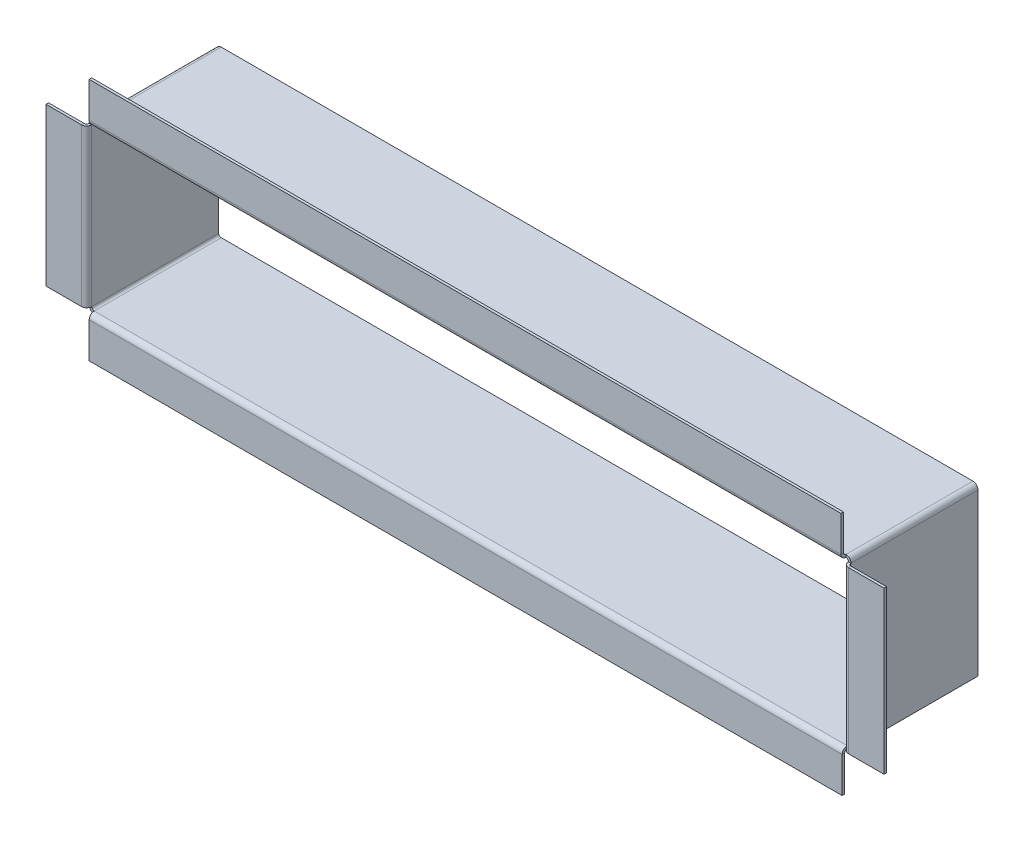
from build123d import *

# Parameters (mm, degrees)
SKETCH1_W                 = 300
SKETCH1_H                 = 66
SKETCH1_W_2               = 298
SKETCH1_H_2               = 64
BOSS_EXTRUDE1_DEPTH       = 50
CONVERT_SOLID1_DEPTH      = 50
CONVERT_SOLID1_2_DEPTH    = 50
EDGE_FLANGE1_DEPTH        = 296
EDGE_FLANGE1_BEND_DEPTH   = 63.5
EDGE_FLANGE1_BEND_2_DEPTH = 296.5
EDGE_FLANGE1_BEND_3_DEPTH = 62


# Read off the part's stored shape, not the designer's step: Convert-Solid1
# Sheet-metal steps are written as plain solids
with BuildPart() as part:
    # Sketch1 → Boss-Extrude1 (new body)
    with BuildSketch(Plane.XY):
        Rectangle(SKETCH1_W, SKETCH1_H)
        Rectangle(SKETCH1_W_2, SKETCH1_H_2, mode=Mode.SUBTRACT)
    extrude(amount=BOSS_EXTRUDE1_DEPTH)

    # Convert-Solid1 outline → Convert-Solid1 (cut)
    with BuildSketch(Plane.XY):
        Polygon((149, -32.5), (149, -32), (148.5, -32), (148.5, -33), (150, -33), (150, -32.5), align=None)
        with BuildLine():
            ThreePointArc((148, 33), (149.414213562, 32.414213562), (150, 31))
            Line((150, 31), (150, 33))
            Line((150, 33), (148, 33))
        make_face()
        with BuildLine():
            Line((-150, -33), (-148, -33))
            ThreePointArc((-148, -33), (-149.414213562, -32.414213562), (-150, -31))
            Line((-150, -31), (-150, -33))
        make_face()
        with BuildLine():
            ThreePointArc((-150, 31), (-149.414213562, 32.414213562), (-148, 33))
            Line((-148, 33), (-150, 33))
            Line((-150, 33), (-150, 31))
        make_face()
    extrude(amount=CONVERT_SOLID1_DEPTH, mode=Mode.SUBTRACT)

    # Convert-Solid1 2 outline → Convert-Solid1 2 (add)
    with BuildSketch(Plane.XY):
        with BuildLine():
            ThreePointArc((148, 32), (148.707106781, 31.707106781), (149, 31))
            Line((149, 31), (149, 32))
            Line((149, 32), (148, 32))
        make_face()
        with BuildLine():
            ThreePointArc((-149, 31), (-148.707106781, 31.707106781), (-148, 32))
            Line((-148, 32), (-149, 32))
            Line((-149, 32), (-149, 31))
        make_face()
        with BuildLine():
            Line((-149, -32), (-148, -32))
            ThreePointArc((-148, -32), (-148.707106781, -31.707106781), (-149, -31))
            Line((-149, -31), (-149, -32))
        make_face()
    extrude(amount=CONVERT_SOLID1_2_DEPTH)

    # Edge-Flange1 section (across the edge) → Edge-Flange1 (add)
    with BuildSketch(Plane(origin=(-148, 33, 51), x_dir=(0, 0, -1), z_dir=(1, 0, 0))):
        with BuildLine():
            Line((-1, 1), (-1, 15))
            Line((-1, 15), (0, 15))
            Line((0, 15), (0, 1))
            ThreePointArc((0, 1), (0.292893219, 0.292893219), (1, 0))
            Line((1, 0), (1, -1))
            ThreePointArc((1, -1), (-0.414213562, -0.414213562), (-1, 1))
        make_face()
    extrude(amount=EDGE_FLANGE1_DEPTH)

    # Edge-Flange1 section 2 (across the edge) → Edge-Flange1 bend (add)
    with BuildSketch(Plane(origin=(150, 31, 51), x_dir=(0, 0, -1), z_dir=(0, -1, 0))):
        with BuildLine():
            Line((-1, 1), (-1, 15))
            Line((-1, 15), (0, 15))
            Line((0, 15), (0, 1))
            ThreePointArc((0, 1), (0.292893219, 0.292893219), (1, 0))
            Line((1, 0), (1, -1))
            ThreePointArc((1, -1), (-0.414213562, -0.414213562), (-1, 1))
        make_face()
    extrude(amount=EDGE_FLANGE1_BEND_DEPTH)

    # Edge-Flange1 section 3 (across the edge) → Edge-Flange1 bend 2 (add)
    with BuildSketch(Plane(origin=(148.5, -33, 51), x_dir=(0, 0, -1), z_dir=(-1, 0, 0))):
        with BuildLine():
            Line((-1, 1), (-1, 15))
            Line((-1, 15), (0, 15))
            Line((0, 15), (0, 1))
            ThreePointArc((0, 1), (0.292893219, 0.292893219), (1, 0))
            Line((1, 0), (1, -1))
            ThreePointArc((1, -1), (-0.414213562, -0.414213562), (-1, 1))
        make_face()
    extrude(amount=EDGE_FLANGE1_BEND_2_DEPTH)

    # Edge-Flange1 section 4 (across the edge) → Edge-Flange1 bend 3 (add)
    with BuildSketch(Plane(origin=(-150, -31, 51), x_dir=(0, 0, -1), z_dir=(0, 1, 0))):
        with BuildLine():
            Line((-1, 1), (-1, 15))
            Line((-1, 15), (0, 15))
            Line((0, 15), (0, 1))
            ThreePointArc((0, 1), (0.292893219, 0.292893219), (1, 0))
            Line((1, 0), (1, -1))
            ThreePointArc((1, -1), (-0.414213562, -0.414213562), (-1, 1))
        make_face()
    extrude(amount=EDGE_FLANGE1_BEND_3_DEPTH)


solid = part.part
